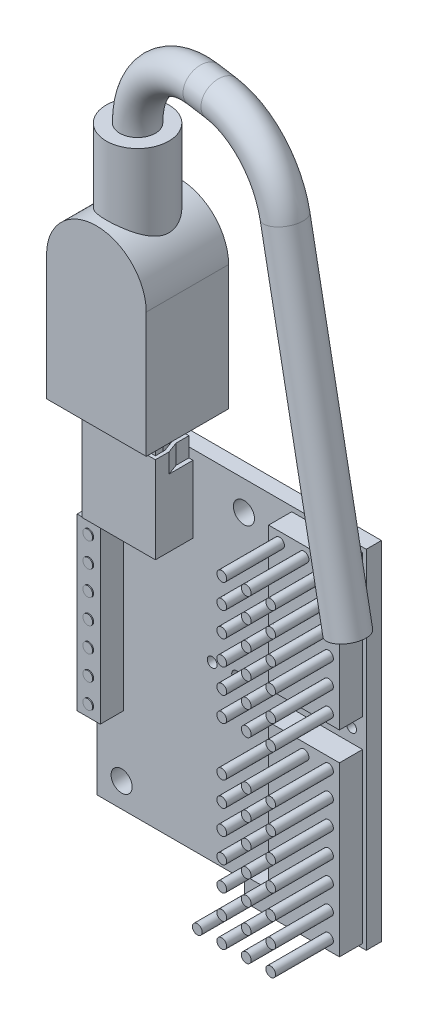
from build123d import *

# Parameters (mm, degrees)
BOSS_EXTRUDE1_START       = -1.5748
BOSS_EXTRUDE1_OUTLINE_W   = 27.94
BOSS_EXTRUDE1_OUTLINE_H   = 36.068
BOSS_EXTRUDE1_OUTLINE_R   = 1.0922
BOSS_EXTRUDE1_OUTLINE_R_2 = 0.508
BOSS_EXTRUDE1_DEPTH       = 1.5748
BOSS_EXTRUDE1_2_OUTLINE_W = 7.6
BOSS_EXTRUDE1_2_OUTLINE_H = 9
BOSS_EXTRUDE1_2_DEPTH     = 3.9
CUT_EXTRUDE1_DEPTH        = 2
SKETCH3_W                 = 7.35
SKETCH3_H                 = 14.75
SKETCH3_W_2               = 2.4
SKETCH3_H_2               = 17.7
BOSS_EXTRUDE2_DEPTH       = 2.4
SKETCH4_R                 = 0.508
BOSS_EXTRUDE3_DEPTH       = 6
BOSS_EXTRUDE4_DEPTH       = 4.15
SKETCH7_W                 = 10.35
SKETCH7_H                 = 8.55
BOSS_EXTRUDE5_DEPTH       = 18.15
CUT_EXTRUDE2_DEPTH        = 18.15
SKETCH9_R                 = 3.25
BOSS_EXTRUDE6_DEPTH       = 25.25
SKETCH12_R                = 1.85
CUT_EXTRUDE3_START        = 0.1
SKETCH15_W                = 2.4
SKETCH15_H                = 17.7
CUT_EXTRUDE3_DEPTH        = 10


with BuildPart() as part:
    # Boss-Extrude1: read off the stored shape, not the designer's step
    # Boss-Extrude1 outline → Boss-Extrude1 (new body)
    with BuildSketch(Plane.XY.offset(1.5748).offset(BOSS_EXTRUDE1_START)):
        with Locations((13.97, 18.034)):
            Rectangle(BOSS_EXTRUDE1_OUTLINE_W, BOSS_EXTRUDE1_OUTLINE_H)
        with Locations((2.54, 2.54)):
            Circle(BOSS_EXTRUDE1_OUTLINE_R, mode=Mode.SUBTRACT)
        with Locations((1.524, 10.16)):
            Circle(BOSS_EXTRUDE1_OUTLINE_R_2, mode=Mode.SUBTRACT)
        with Locations((1.524, 12.7)):
            Circle(BOSS_EXTRUDE1_OUTLINE_R_2, mode=Mode.SUBTRACT)
        with Locations((1.524, 15.24)):
            Circle(BOSS_EXTRUDE1_OUTLINE_R_2, mode=Mode.SUBTRACT)
        with Locations((1.524, 17.78)):
            Circle(BOSS_EXTRUDE1_OUTLINE_R_2, mode=Mode.SUBTRACT)
        with Locations((11.938, 17.907)):
            Circle(BOSS_EXTRUDE1_OUTLINE_R_2, mode=Mode.SUBTRACT)
        with Locations((18.796, 1.524)):
            Circle(BOSS_EXTRUDE1_OUTLINE_R_2, mode=Mode.SUBTRACT)
        with Locations((21.336, 1.524)):
            Circle(BOSS_EXTRUDE1_OUTLINE_R_2, mode=Mode.SUBTRACT)
        with Locations((23.876, 1.524)):
            Circle(BOSS_EXTRUDE1_OUTLINE_R_2, mode=Mode.SUBTRACT)
        with Locations((21.336, 4.064)):
            Circle(BOSS_EXTRUDE1_OUTLINE_R_2, mode=Mode.SUBTRACT)
        with Locations((23.876, 4.064)):
            Circle(BOSS_EXTRUDE1_OUTLINE_R_2, mode=Mode.SUBTRACT)
        with Locations((26.416, 1.524)):
            Circle(BOSS_EXTRUDE1_OUTLINE_R_2, mode=Mode.SUBTRACT)
        with Locations((26.416, 4.064)):
            Circle(BOSS_EXTRUDE1_OUTLINE_R_2, mode=Mode.SUBTRACT)
        with Locations((21.336, 6.604)):
            Circle(BOSS_EXTRUDE1_OUTLINE_R_2, mode=Mode.SUBTRACT)
        with Locations((23.876, 6.604)):
            Circle(BOSS_EXTRUDE1_OUTLINE_R_2, mode=Mode.SUBTRACT)
        with Locations((21.336, 9.144)):
            Circle(BOSS_EXTRUDE1_OUTLINE_R_2, mode=Mode.SUBTRACT)
        with Locations((23.876, 9.144)):
            Circle(BOSS_EXTRUDE1_OUTLINE_R_2, mode=Mode.SUBTRACT)
        with Locations((26.416, 6.604)):
            Circle(BOSS_EXTRUDE1_OUTLINE_R_2, mode=Mode.SUBTRACT)
        with Locations((26.416, 9.144)):
            Circle(BOSS_EXTRUDE1_OUTLINE_R_2, mode=Mode.SUBTRACT)
        with Locations((14.478, 17.907)):
            Circle(BOSS_EXTRUDE1_OUTLINE_R_2, mode=Mode.SUBTRACT)
        with Locations((21.336, 11.684)):
            Circle(BOSS_EXTRUDE1_OUTLINE_R_2, mode=Mode.SUBTRACT)
        with Locations((23.876, 11.684)):
            Circle(BOSS_EXTRUDE1_OUTLINE_R_2, mode=Mode.SUBTRACT)
        with Locations((26.416, 11.684)):
            Circle(BOSS_EXTRUDE1_OUTLINE_R_2, mode=Mode.SUBTRACT)
        with Locations((21.336, 14.224)):
            Circle(BOSS_EXTRUDE1_OUTLINE_R_2, mode=Mode.SUBTRACT)
        with Locations((23.876, 14.224)):
            Circle(BOSS_EXTRUDE1_OUTLINE_R_2, mode=Mode.SUBTRACT)
        with Locations((21.336, 16.764)):
            Circle(BOSS_EXTRUDE1_OUTLINE_R_2, mode=Mode.SUBTRACT)
        with Locations((23.876, 16.764)):
            Circle(BOSS_EXTRUDE1_OUTLINE_R_2, mode=Mode.SUBTRACT)
        with Locations((26.416, 14.224)):
            Circle(BOSS_EXTRUDE1_OUTLINE_R_2, mode=Mode.SUBTRACT)
        with Locations((26.416, 16.764)):
            Circle(BOSS_EXTRUDE1_OUTLINE_R_2, mode=Mode.SUBTRACT)
        with Locations((1.524, 20.32)):
            Circle(BOSS_EXTRUDE1_OUTLINE_R_2, mode=Mode.SUBTRACT)
        with Locations((1.524, 22.86)):
            Circle(BOSS_EXTRUDE1_OUTLINE_R_2, mode=Mode.SUBTRACT)
        with Locations((1.524, 25.4)):
            Circle(BOSS_EXTRUDE1_OUTLINE_R_2, mode=Mode.SUBTRACT)
        with Locations((21.336, 19.304)):
            Circle(BOSS_EXTRUDE1_OUTLINE_R_2, mode=Mode.SUBTRACT)
        with Locations((23.876, 19.304)):
            Circle(BOSS_EXTRUDE1_OUTLINE_R_2, mode=Mode.SUBTRACT)
        with Locations((21.336, 21.844)):
            Circle(BOSS_EXTRUDE1_OUTLINE_R_2, mode=Mode.SUBTRACT)
        with Locations((23.876, 21.844)):
            Circle(BOSS_EXTRUDE1_OUTLINE_R_2, mode=Mode.SUBTRACT)
        with Locations((26.416, 19.304)):
            Circle(BOSS_EXTRUDE1_OUTLINE_R_2, mode=Mode.SUBTRACT)
        with Locations((26.416, 21.844)):
            Circle(BOSS_EXTRUDE1_OUTLINE_R_2, mode=Mode.SUBTRACT)
        with Locations((21.336, 24.384)):
            Circle(BOSS_EXTRUDE1_OUTLINE_R_2, mode=Mode.SUBTRACT)
        with Locations((23.876, 24.384)):
            Circle(BOSS_EXTRUDE1_OUTLINE_R_2, mode=Mode.SUBTRACT)
        with Locations((21.336, 26.924)):
            Circle(BOSS_EXTRUDE1_OUTLINE_R_2, mode=Mode.SUBTRACT)
        with Locations((23.876, 26.924)):
            Circle(BOSS_EXTRUDE1_OUTLINE_R_2, mode=Mode.SUBTRACT)
        with Locations((26.416, 24.384)):
            Circle(BOSS_EXTRUDE1_OUTLINE_R_2, mode=Mode.SUBTRACT)
        with Locations((26.416, 26.924)):
            Circle(BOSS_EXTRUDE1_OUTLINE_R_2, mode=Mode.SUBTRACT)
        with Locations((15.24, 33.02)):
            Circle(BOSS_EXTRUDE1_OUTLINE_R, mode=Mode.SUBTRACT)
        with Locations((21.336, 29.464)):
            Circle(BOSS_EXTRUDE1_OUTLINE_R_2, mode=Mode.SUBTRACT)
        with Locations((23.876, 29.464)):
            Circle(BOSS_EXTRUDE1_OUTLINE_R_2, mode=Mode.SUBTRACT)
        with Locations((21.336, 32.004)):
            Circle(BOSS_EXTRUDE1_OUTLINE_R_2, mode=Mode.SUBTRACT)
        with Locations((23.876, 32.004)):
            Circle(BOSS_EXTRUDE1_OUTLINE_R_2, mode=Mode.SUBTRACT)
        with Locations((26.416, 29.464)):
            Circle(BOSS_EXTRUDE1_OUTLINE_R_2, mode=Mode.SUBTRACT)
        with Locations((26.416, 32.004)):
            Circle(BOSS_EXTRUDE1_OUTLINE_R_2, mode=Mode.SUBTRACT)
        with Locations((21.336, 34.544)):
            Circle(BOSS_EXTRUDE1_OUTLINE_R_2, mode=Mode.SUBTRACT)
        with Locations((23.876, 34.544)):
            Circle(BOSS_EXTRUDE1_OUTLINE_R_2, mode=Mode.SUBTRACT)
        with Locations((26.416, 34.544)):
            Circle(BOSS_EXTRUDE1_OUTLINE_R_2, mode=Mode.SUBTRACT)
        with Locations((3.94716, 31.0261)):
            Circle(BOSS_EXTRUDE1_OUTLINE_R_2, mode=Mode.SUBTRACT)
        with Locations((8.34644, 31.0261)):
            Circle(BOSS_EXTRUDE1_OUTLINE_R_2, mode=Mode.SUBTRACT)
    extrude(amount=BOSS_EXTRUDE1_DEPTH)

    # Boss-Extrude1 2 outline → Boss-Extrude1 2 (add)
    with BuildSketch(Plane.XY.offset(1.5748)):
        with Locations((6.1468, 32.568)):
            Rectangle(BOSS_EXTRUDE1_2_OUTLINE_W, BOSS_EXTRUDE1_2_OUTLINE_H)
    extrude(amount=BOSS_EXTRUDE1_2_DEPTH)

    # Sketch2 → Cut-Extrude1 (cut)
    with BuildSketch(Plane(origin=(0, 37.068, 0), x_dir=(1, 0, 0), z_dir=(0, 1, 0))):
        Polygon((3.1218, -1.9248), (3.1218, -2.9748), (2.6968, -4.1248), (2.6968, -5.1248), (9.5968, -5.1248), (9.5968, -4.1248), (9.1718, -2.9748), (9.1718, -1.9248), align=None)
        Polygon((2.7718, -1.5748), (2.7718, -2.912195308), (2.3468, -4.062195308), (2.3468, -1.5748), align=None)
        Polygon((9.9468, -1.5748), (9.5218, -1.5748), (9.5218, -2.912195308), (9.9468, -4.062195308), align=None)
    extrude(amount=-CUT_EXTRUDE1_DEPTH, mode=Mode.SUBTRACT)

    # Sketch3 → Boss-Extrude2 (add)
    with BuildSketch(Plane.XY.offset(1.5748)):
        with Locations((23.876, 28.194)):
            Rectangle(SKETCH3_W, SKETCH3_H)
        Polygon((20.201, 17.869), (27.551, 17.869), (27.551, 0.419), (17.701, 0.419), (17.701, 2.819), (20.201, 2.819), align=None)
        with Locations((1.524, 17.78)):
            Rectangle(SKETCH3_W_2, SKETCH3_H_2)
    extrude(amount=BOSS_EXTRUDE2_DEPTH)

    # Sketch4 → Boss-Extrude3 (add)
    with BuildSketch(Plane.XY.offset(3.9748)):
        with Locations((1.524, 25.4)):
            Circle(SKETCH4_R)
        with Locations((1.524, 22.86)):
            Circle(SKETCH4_R)
        with Locations((1.524, 20.32)):
            Circle(SKETCH4_R)
        with Locations((1.524, 17.78)):
            Circle(SKETCH4_R)
        with Locations((1.524, 15.24)):
            Circle(SKETCH4_R)
        with Locations((21.336, 34.544)):
            Circle(SKETCH4_R)
        with Locations((21.336, 32.004)):
            Circle(SKETCH4_R)
        with Locations((21.336, 29.464)):
            Circle(SKETCH4_R)
        with Locations((21.336, 26.924)):
            Circle(SKETCH4_R)
        with Locations((21.336, 24.384)):
            Circle(SKETCH4_R)
        with Locations((21.336, 21.844)):
            Circle(SKETCH4_R)
        with Locations((21.336, 16.764)):
            Circle(SKETCH4_R)
        with Locations((21.336, 14.224)):
            Circle(SKETCH4_R)
        with Locations((21.336, 11.684)):
            Circle(SKETCH4_R)
        with Locations((21.336, 9.144)):
            Circle(SKETCH4_R)
        with Locations((21.336, 6.604)):
            Circle(SKETCH4_R)
        with Locations((21.336, 4.064)):
            Circle(SKETCH4_R)
        with Locations((26.416, 34.544)):
            Circle(SKETCH4_R)
        with Locations((23.876, 34.544)):
            Circle(SKETCH4_R)
        with Locations((26.416, 32.004)):
            Circle(SKETCH4_R)
        with Locations((23.876, 32.004)):
            Circle(SKETCH4_R)
        with Locations((26.416, 29.464)):
            Circle(SKETCH4_R)
        with Locations((23.876, 29.464)):
            Circle(SKETCH4_R)
        with Locations((26.416, 26.924)):
            Circle(SKETCH4_R)
        with Locations((23.876, 26.924)):
            Circle(SKETCH4_R)
        with Locations((26.416, 24.384)):
            Circle(SKETCH4_R)
        with Locations((23.876, 24.384)):
            Circle(SKETCH4_R)
        with Locations((26.416, 21.844)):
            Circle(SKETCH4_R)
        with Locations((23.876, 21.844)):
            Circle(SKETCH4_R)
        with Locations((26.416, 16.764)):
            Circle(SKETCH4_R)
        with Locations((23.876, 16.764)):
            Circle(SKETCH4_R)
        with Locations((26.416, 14.224)):
            Circle(SKETCH4_R)
        with Locations((23.876, 14.224)):
            Circle(SKETCH4_R)
        with Locations((26.416, 11.684)):
            Circle(SKETCH4_R)
        with Locations((23.876, 11.684)):
            Circle(SKETCH4_R)
        with Locations((26.416, 9.144)):
            Circle(SKETCH4_R)
        with Locations((23.876, 9.144)):
            Circle(SKETCH4_R)
        with Locations((26.416, 6.604)):
            Circle(SKETCH4_R)
        with Locations((23.876, 6.604)):
            Circle(SKETCH4_R)
        with Locations((26.416, 4.064)):
            Circle(SKETCH4_R)
        with Locations((23.876, 4.064)):
            Circle(SKETCH4_R)
        with Locations((26.416, 1.524)):
            Circle(SKETCH4_R)
        with Locations((23.876, 1.524)):
            Circle(SKETCH4_R)
        with Locations((1.524, 12.7)):
            Circle(SKETCH4_R)
        with Locations((21.336, 1.524)):
            Circle(SKETCH4_R)
        with Locations((1.524, 10.16)):
            Circle(SKETCH4_R)
        with Locations((18.796, 1.524)):
            Circle(SKETCH4_R)
    extrude(amount=BOSS_EXTRUDE3_DEPTH)

    # Sketch6 → Boss-Extrude4 (add)
    with BuildSketch(Plane(origin=(0, 35.068, 0), x_dir=(1, 0, 0), z_dir=(0, 1, 0))):
        Polygon((8.9718, -2.1248), (3.3218, -2.1248), (3.3218, -3.01057411), (2.8968, -4.16057411), (2.8968, -4.9248), (9.3968, -4.9248), (9.3968, -4.16057411), (8.9718, -3.01057411), align=None)
    extrude(amount=BOSS_EXTRUDE4_DEPTH)

    # Sketch7 → Boss-Extrude5 (add)
    with BuildSketch(Plane(origin=(0, 39.218, 0), x_dir=(1, 0, 0), z_dir=(0, 1, 0))):
        with Locations((6.1468, -3.5248)):
            Rectangle(SKETCH7_W, SKETCH7_H)
    extrude(amount=BOSS_EXTRUDE5_DEPTH)

    # Sketch8 → Cut-Extrude2 (cut)
    with BuildSketch(Plane.XY.offset(7.7998)):
        with BuildLine():
            Line((11.3218, 52.193), (11.3218, 58.760178051))
            Line((11.3218, 58.760178051), (0.9718, 58.760178051))
            Line((0.9718, 58.760178051), (0.9718, 52.193))
            ThreePointArc((0.9718, 52.193), (6.1468, 57.368), (11.3218, 52.193))
        make_face()
    extrude(amount=-CUT_EXTRUDE2_DEPTH, mode=Mode.SUBTRACT)

    # Sketch9 → Boss-Extrude6 (add)
    with BuildSketch(Plane.XZ.offset(-39.218)):
        with Locations(Location((6.1468, 3.5248, 0), (0, 0, 270))):
            Circle(SKETCH9_R)
    extrude(amount=-BOSS_EXTRUDE6_DEPTH)

    # Sweep1: sweep along a path in Sketch11
    with BuildLine(Plane(origin=(-0.366724972, 0, 2.609383764), x_dir=(0.9902680687415703, 0, 0.13917310096006577), z_dir=(-0.13917310096006577, 0, 0.9902680687415703))) as sweep1_path:
        Line((32.22243251, 33.086282069), (24.561919713, 66.267608435))
        ThreePointArc((24.561919713, 66.267608435), (21.747076288, 70.728865255), (16.766959195, 72.468))
        Line((16.766959195, 72.468), (14.577537111, 72.468))
        ThreePointArc((14.577537111, 72.468), (8.920682862, 70.124854249), (6.577537111, 64.468))
    # Sketch12 → Sweep1 (sweep)
    with BuildSketch(Plane(origin=(0, 64.468, 0), x_dir=(1, 0, 0), z_dir=(0, 1, 0))):
        with Locations((6.1468, -3.5248)):
            Circle(SKETCH12_R)
    sweep(path=sweep1_path.line)

    # Sketch15 → Cut-Extrude3 (cut)
    with BuildSketch(Plane.XY.offset(3.9748).offset(CUT_EXTRUDE3_START)):
        with Locations((1.524, 17.78)):
            Rectangle(SKETCH15_W, SKETCH15_H)
    extrude(amount=CUT_EXTRUDE3_DEPTH, mode=Mode.SUBTRACT)


solid = part.part
